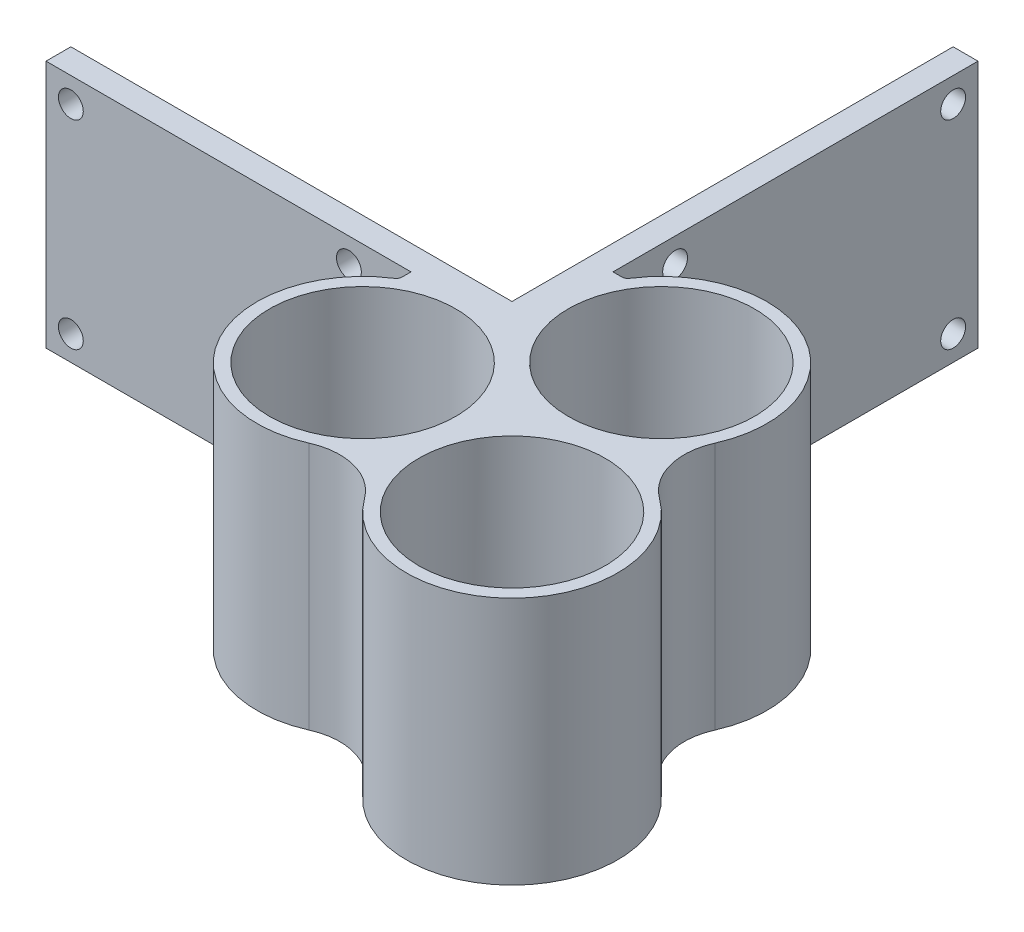
from build123d import *
from build123d.topology import SkipClean

# Parameters (mm, degrees)
SKETCH1_W            = 30
SKETCH1_H            = 30
BOSS_EXTRUDE1_DEPTH  = 80
SKETCH2_R            = 6
BOSS_EXTRUDE2_DEPTH  = 22
CUT_EXTRUDE1_DEPTH   = 83.764726786
BOSS_EXTRUDE3_DEPTH  = 100
BOSS_EXTRUDE5_DEPTH  = 2
BOSS_EXTRUDE6_DEPTH  = 23
BOSS_EXTRUDE7_DEPTH  = 25
FILLET1_R            = 2
SKETCH11_R           = 6.055782361
CUT_EXTRUDE2_DEPTH   = 2.125
SKETCH12_W           = 13.25
SKETCH12_H           = 8.5
CUT_EXTRUDE4_DEPTH   = 13.25
CUT_EXTRUDE5_REACH   = 204.341
SKETCH15_W           = 3.75
SKETCH15_H           = 3.75
FILLET2_R            = 1
CUT_EXTRUDE7_START   = 22
SKETCH16_R           = 6
CUT_EXTRUDE7_DEPTH   = 22
SKETCH17_R           = 15
BOSS_EXTRUDE8_DEPTH  = 40
FILLET3_R            = 1
SKETCH18_R           = 15
SKETCH18_R_2         = 7.5
BOSS_EXTRUDE9_DEPTH  = 2
SKETCH22_R           = 209.016423622
CUT_EXTRUDE8_DEPTH   = 225.815151847
SKETCH23_W           = 22.070362909
SKETCH23_H           = 16.212180161
CUT_EXTRUDE9_DEPTH   = 65.514197169
SKETCH24_R           = 15
BOSS_EXTRUDE10_DEPTH = 40
SKETCH25_R           = 15
SKETCH25_R_2         = 7.5
BOSS_EXTRUDE11_DEPTH = 2
BOSS_EXTRUDE12_DEPTH = 40
SKETCH29_R           = 2
CUT_EXTRUDE10_DEPTH  = 209.128716183
SKETCH30_R           = 3.025
CUT_EXTRUDE11_DEPTH  = 2.1


with BuildPart() as part:
    # Sketch1 → Boss-Extrude1 (new body)
    with BuildSketch(Plane(origin=(0, 0, 0), x_dir=(1, 0, 0), z_dir=(0, 1, 0))):
        Rectangle(SKETCH1_W, SKETCH1_H)
    extrude(amount=BOSS_EXTRUDE1_DEPTH)

    # Sketch2 → Boss-Extrude2 (add)
    with BuildSketch(Plane(origin=(0, 80, 0), x_dir=(1, 0, 0), z_dir=(0, 1, 0))):
        with Locations(Location((9, -9, 0), (0, 0, 270))):
            Circle(SKETCH2_R)
    extrude(amount=BOSS_EXTRUDE2_DEPTH)

    # Sketch3 → Cut-Extrude1 (cut, through all)
    with BuildSketch(Plane(origin=(0, 80, 0), x_dir=(1, 0, 0), z_dir=(0, 1, 0))):
        with BuildLine():
            Line((9, -15), (15, -15))
            Line((15, -15), (15, -9))
            ThreePointArc((15, -9), (13.242640687, -13.242640687), (9, -15))
        make_face()
    extrude(amount=-CUT_EXTRUDE1_DEPTH, mode=Mode.SUBTRACT)

    # Sketch4 → Boss-Extrude3 (add)
    with BuildSketch(Plane(origin=(0, 80, 0), x_dir=(1, 0, 0), z_dir=(0, 1, 0))):
        Polygon((-8.25, 11.25), (-8.25, 8.25), (-11.25, 8.25), (-15, 8.25), (-15, 11.25), (-11.25, 11.25), (-11.25, 15), (-8.25, 15), align=None)
        Polygon((-1.75, 1.75), (-11.25, 1.75), (-15, 1.75), (-15, -1.25), (-11.25, -1.25), (1.25, -1.25), (1.25, 11.25), (1.25, 15), (-1.75, 15), (-1.75, 11.25), align=None)
    extrude(amount=BOSS_EXTRUDE3_DEPTH)

    # Sketch6 → Boss-Extrude5 (add)
    with BuildSketch(Plane.XZ):
        with BuildLine():
            Line((15, -15), (7, -15))
            Line((7, -15), (7, -99.5))
            ThreePointArc((7, -99.5), (2.757359313, -109.742640687), (13, -105.5))
            Line((13, -105.5), (15, -105.5))
            Line((15, -105.5), (15, -15))
        make_face()
    extrude(amount=-BOSS_EXTRUDE5_DEPTH)

    # Sketch7 → Boss-Extrude6 (add)
    with SkipClean():  # the faces are left unmerged after this step: merging them gives an invalid solid
        with BuildSketch(Plane(origin=(0, 2, 0), x_dir=(1, 0, 0), z_dir=(0, 1, 0))):
            with BuildLine():
                Line((9, 111.156854249), (9, 108.964101615))
                ThreePointArc((9, 108.964101615), (7, 101.5), (5, 108.964101615))
                Line((5, 108.964101615), (5, 111.156854249))
                ThreePointArc((5, 111.156854249), (1.086408642, 104.485388128), (7, 99.5))
                Line((7, 99.5), (7, 15))
                Line((7, 15), (15, 15))
                Line((15, 15), (15, 105.5))
                Line((15, 105.5), (13, 105.5))
                ThreePointArc((13, 105.5), (11.898979486, 108.964101615), (9, 111.156854249))
            make_face()
        extrude(amount=BOSS_EXTRUDE6_DEPTH)

    # Sketch9 → Boss-Extrude7 (add)
    with SkipClean():  # the faces are left unmerged after this step: merging them gives an invalid solid
        with BuildSketch(Plane.XZ):
            with BuildLine():
                Line((-15, 15), (-15, 7))
                Line((-15, 7), (-126.175, 7))
                ThreePointArc((-126.175, 7), (-126.252697751, 6.037536458), (-126.48377869, 5.1))
                Line((-126.48377869, 5.1), (-128.797778509, 5.1))
                ThreePointArc((-128.797778509, 5.1), (-136.05, 7), (-128.797778509, 8.9))
                Line((-128.797778509, 8.9), (-126.3, 8.9))
                ThreePointArc((-126.3, 8.9), (-128.491885554, 11.955834237), (-132.050001601, 13.173329766))
                Line((-132.050001601, 13.173329766), (-132.050001601, 15))
                Line((-132.050001601, 15), (-15, 15))
            make_face()
        extrude(amount=-BOSS_EXTRUDE7_DEPTH)

    # Fillet1
    fillet1_edges = [part.edges().sort_by_distance(p)[0] for p in [
        (-126.175, 12.5, 7),
    ]]
    fillet(fillet1_edges, radius=FILLET1_R)

    # Sketch11 → Cut-Extrude2 (cut)
    with SkipClean():  # the faces are left unmerged after this step: merging them gives an invalid solid
        with BuildSketch(Plane.XZ):
            with Locations((-132.175, 7)):
                Circle(SKETCH11_R)
        extrude(amount=-CUT_EXTRUDE2_DEPTH, mode=Mode.SUBTRACT)

    # Sketch12 → Cut-Extrude4 (cut)
    with SkipClean():  # the faces are left unmerged after this step: merging them gives an invalid solid
        with BuildSketch(Plane.ZY.offset(15)):
            with Locations((-8.375, 72.75)):
                Rectangle(SKETCH12_W, SKETCH12_H)
        extrude(amount=-CUT_EXTRUDE4_DEPTH, mode=Mode.SUBTRACT)

    # Sketch15 → Cut-Extrude5 (cut, up to next)
    with BuildSketch(Plane(origin=(0, 80, 0), x_dir=(1, 0, 0), z_dir=(0, 1, 0)), mode=Mode.PRIVATE) as cut_extrude5_sk1:
        with Locations((-13.125, 13.125)):
            Rectangle(SKETCH15_W, SKETCH15_H)
    cut_extrude5_tool1 = extrude(cut_extrude5_sk1.sketch, amount=-CUT_EXTRUDE5_REACH, mode=Mode.PRIVATE) & part.part
    add(cut_extrude5_tool1.solids().sort_by_distance((-13.125, 80, -13.125))[0], mode=Mode.SUBTRACT)

    # Fillet2
    fillet2_edges = [part.edges().sort_by_distance(p)[0] for p in [
        (-11.25, 130, -15),
        (-11.25, 130, -11.25),
        (-15, 130, -11.25),
        (-15, 130, 1.25),
        (1.25, 130, -15),
    ]]
    fillet(fillet2_edges, radius=FILLET2_R)

    # Sketch16 → Cut-Extrude7 (cut)
    with SkipClean():  # the faces are left unmerged after this step: merging them gives an invalid solid
        with BuildSketch(Plane(origin=(0, 80, 0), x_dir=(1, 0, 0), z_dir=(0, 1, 0)).offset(CUT_EXTRUDE7_START)):
            with Locations((9, -9)):
                Circle(SKETCH16_R)
        extrude(amount=-CUT_EXTRUDE7_DEPTH, mode=Mode.SUBTRACT)


with BuildPart() as cut_extrude7_kept_piece:
    # of the separate pieces the step leaves, the one the design keeps (cut_extrude7_pieces_kept)
    add(part.part.solids().sort_by_distance((-15, 80, 0.25))[0])

    # Sketch17 → Boss-Extrude8 (add)
    with SkipClean():  # the faces are left unmerged after this step: merging them gives an invalid solid
        with BuildSketch(Plane(origin=(0, 180, 0), x_dir=(1, 0, 0), z_dir=(0, 1, 0))):
            with BuildLine():
                Line((-14, -1.25), (-14, -4.216394713))
                ThreePointArc((-14, -4.216394713), (-14.384018227, -33.129332993), (11.657578086, -20.561885701))
                ThreePointArc((11.657578086, -20.561885701), (14.532144442, -14.532144442), (20.561885701, -11.657578086))
                ThreePointArc((20.561885701, -11.657578086), (33.129332993, 14.384018227), (4.216394713, 14))
                Line((4.216394713, 14), (1.25, 14))
                Line((1.25, 14), (1.25, -1.25))
                Line((1.25, -1.25), (-14, -1.25))
            make_face()
            with Locations(Location((18.79163056, 5.25, 0), (0, 0, 270))):
                Circle(SKETCH17_R, mode=Mode.SUBTRACT)
            with Locations(Location((-5.25, -18.79163056, 0), (0, 0, 270))):
                Circle(SKETCH17_R, mode=Mode.SUBTRACT)
        extrude(amount=-BOSS_EXTRUDE8_DEPTH)

    # Fillet3
    # the kernel refuses this fillet: 1 mm, written as the material it adds along each edge
    with BuildSketch(Plane(origin=(-14, 140, 1.25), x_dir=(-0.9659258262890684, 0, -0.25881904510252046), z_dir=(0, 1, 0))) as fillet3_piece_1:
        with BuildLine():
            CenterArc((0.776457135, 0.965925826), FILLET3_R, 195, 60)
            Line((-0.189468691, 0.707106781), (0, 0))
            ThreePointArc((0, 0), (0.258819045, 0.034074174), (0.51763809, 0))
        make_face()
    extrude(amount=40)
    with BuildSketch(Plane(origin=(-14, 180, 4.216394713), x_dir=(0, 0, -1), z_dir=(0, -1, 0))) as fillet3_piece_2:
        with BuildLine():
            CenterArc((0.555444904, -1), FILLET3_R, 90, 57.202831704)
            ThreePointArc((-0.285148471, -0.458333333), (-0.140754957, -0.230298516), (0, 0))
            Line((0, 0), (0.555444904, 0))
        make_face()
    extrude(amount=40)
    with BuildSketch(Plane(origin=(1.25, 140, -14), x_dir=(-0.2588190451025201, 0, -0.9659258262890685), z_dir=(0, 1, 0))) as fillet3_piece_3:
        with BuildLine():
            CenterArc((0.776457135, -0.965925826), FILLET3_R, 105, 60)
            Line((-0.189468691, -0.707106781), (0, 0))
            ThreePointArc((0, 0), (0.258819045, -0.034074174), (0.51763809, 0))
        make_face()
    extrude(amount=40)
    with BuildSketch(Plane(origin=(4.216394713, 180, -14), x_dir=(-1, 0, 0), z_dir=(0, -1, 0))) as fillet3_piece_4:
        with BuildLine():
            CenterArc((0.555444904, 1), FILLET3_R, 212.797168296, 57.202831704)
            ThreePointArc((-0.285148471, 0.458333333), (-0.140754957, 0.230298516), (0, 0))
            Line((0, 0), (0.555444904, 0))
        make_face()
    extrude(amount=40)

    # Sketch18 → Boss-Extrude9 (add)
    with SkipClean():  # the faces are left unmerged after this step: merging them gives an invalid solid
        with BuildSketch(Plane.XZ.offset(-140)):
            with Locations(Location((-5.25, 18.79163056, 0), (0, 0, 90))):
                Circle(SKETCH18_R)
            with Locations(Location((-5.25, 18.79163056, 0), (0, 0, 270))):
                Circle(SKETCH18_R_2, mode=Mode.SUBTRACT)
        boss_extrude9 = extrude(amount=-BOSS_EXTRUDE9_DEPTH)

    # Sketch21 → Revolve1 (revolve)
    with SkipClean():  # the faces are left unmerged after this step: merging them gives an invalid solid
        with BuildSketch(Plane(origin=(-5.25, 0, 0), x_dir=(0, 0, -1), z_dir=(-1, 0, 0)), mode=Mode.PRIVATE) as revolve1_sk:
            Polygon((-11.29163056, -142), (-3.79163056, -154.5), (-3.79163056, -142), align=None)
        revolve1 = revolve(revolve1_sk.sketch.rotate(Axis((-5.25, 1065, 18.79163056), (0, -1, 0)), 180), axis=Axis((-5.25, 1065, 18.79163056), (0, -1, 0)))

    # Mirror1: Boss-Extrude9, Revolve1 across plane
    with SkipClean():  # the faces are left unmerged after this step: merging them gives an invalid solid
        add(boss_extrude9.mirror(Plane(origin=(0, 0, 0), x_dir=(0.7071067811865478, 0, 0.7071067811865472), z_dir=(0.7071067811865475, 0, -0.7071067811865477))))
        add(revolve1.mirror(Plane(origin=(0, 0, 0), x_dir=(0.7071067811865478, 0, 0.7071067811865472), z_dir=(0.7071067811865475, 0, -0.7071067811865477))))

    # Sketch22 → Cut-Extrude8 (cut, through all)
    with BuildSketch(Plane.XZ.offset(-140)):
        Circle(SKETCH22_R)
    extrude(amount=CUT_EXTRUDE8_DEPTH, mode=Mode.SUBTRACT)


with BuildPart() as cut_extrude8_piece_1:
    # of the separate pieces the step leaves, piece 1, a body of its own (cut_extrude8_pieces)
    add(cut_extrude7_kept_piece.part.solids().sort_by_distance((4.501543184, 180, -14.458333333))[0])

    # Sketch24 → Boss-Extrude10 (add)
    with BuildSketch(Plane(origin=(0, 180, 0), x_dir=(1, 0, 0), z_dir=(0, 1, 0))):
        with BuildLine():
            ThreePointArc((13.834213525, -37.57835306), (39.612293374, -39.612293374), (37.57835306, -13.834213525))
            ThreePointArc((37.57835306, -13.834213525), (33.79372713, -8.329895406), (34.31915027, -1.67070312))
            ThreePointArc((34.31915027, -1.67070312), (28.778505526, -8.507264569), (20.561885701, -11.657578086))
            ThreePointArc((20.561885701, -11.657578086), (14.532144442, -14.532144442), (11.657578086, -20.561885701))
            ThreePointArc((11.657578086, -20.561885701), (8.507264569, -28.778505526), (1.67070312, -34.31915027))
            ThreePointArc((1.67070312, -34.31915027), (8.329895406, -33.79372713), (13.834213525, -37.57835306))
        make_face()
        with Locations(Location((27.591478094, -27.591478094, 0), (0, 0, 270))):
            Circle(SKETCH24_R, mode=Mode.SUBTRACT)
    extrude(amount=-BOSS_EXTRUDE10_DEPTH)

    # Sketch25 → Boss-Extrude11 (add)
    with BuildSketch(Plane.XZ.offset(-140)):
        with Locations(Location((27.591478094, 27.591478094, 0), (0, 0, 90))):
            Circle(SKETCH25_R)
        with Locations(Location((27.591478094, 27.591478094, 0), (0, 0, 270))):
            Circle(SKETCH25_R_2, mode=Mode.SUBTRACT)
    extrude(amount=-BOSS_EXTRUDE11_DEPTH)

    # Sketch26 → Revolve2 (revolve)
    with BuildSketch(Plane(origin=(0, 0, 0), x_dir=(-0.7071067811865476, 0, -0.7071067811865475), z_dir=(0.7071067811865475, 0, -0.7071067811865476)), mode=Mode.PRIVATE) as revolve2_sk:
        Polygon((-24.020242526, 142), (-24.020242526, 154.5), (-31.520242526, 142), align=None)
    revolve(revolve2_sk.sketch.rotate(Axis((27.591478094, 126.995387654, 27.591478094), (0, 1, 0)), 135), axis=Axis((27.591478094, 126.995387654, 27.591478094), (0, 1, 0)))

    # Sketch27 → Boss-Extrude12 (add)
    with BuildSketch(Plane(origin=(0, 180, 0), x_dir=(1, 0, 0), z_dir=(0, 1, 0))):
        Polygon((2.25, -2.25), (2.25, 72.75), (-1.75, 72.75), (-1.75, 1.75), (-72.75, 1.75), (-72.75, -2.25), align=None)
    extrude(amount=-BOSS_EXTRUDE12_DEPTH)

    # Sketch29 → Cut-Extrude10 (cut, through all)
    with BuildSketch(Plane.XY.offset(2.25)):
        with Locations((-24, 144)):
            Circle(SKETCH29_R)
        with Locations((-24, 176)):
            Circle(SKETCH29_R)
        with Locations((-68.75, 144)):
            Circle(SKETCH29_R)
        with Locations((-68.75, 176)):
            Circle(SKETCH29_R)
    cut_extrude10 = extrude(amount=-CUT_EXTRUDE10_DEPTH, mode=Mode.SUBTRACT)

    # Sketch30 → Cut-Extrude11 (cut)
    with BuildSketch(Plane(origin=(0, 0, -1.75), x_dir=(-1, 0, 0), z_dir=(0, 0, -1))):
        with Locations((14.135, 148)):
            Circle(SKETCH30_R)
        with Locations((29.545, 148)):
            Circle(SKETCH30_R)
        with Locations((44.955, 148)):
            Circle(SKETCH30_R)
        with Locations((60.365, 148)):
            Circle(SKETCH30_R)
        with Locations(Location((60.365, 172, 0), (0, 0, 180))):
            Circle(SKETCH30_R)
        with Locations(Location((44.955, 172, 0), (0, 0, 180))):
            Circle(SKETCH30_R)
        with Locations(Location((29.545, 172, 0), (0, 0, 180))):
            Circle(SKETCH30_R)
        with Locations(Location((14.135, 172, 0), (0, 0, 180))):
            Circle(SKETCH30_R)
    cut_extrude11 = extrude(amount=-CUT_EXTRUDE11_DEPTH, mode=Mode.SUBTRACT)

    # Mirror2: Cut-Extrude10, Cut-Extrude11 across plane
    add(cut_extrude10.mirror(Plane(origin=(0, 0, 0), x_dir=(0.7071067811865476, 0, 0.7071067811865475), z_dir=(0.7071067811865475, 0, -0.7071067811865476))), mode=Mode.SUBTRACT)
    add(cut_extrude11.mirror(Plane(origin=(0, 0, 0), x_dir=(0.7071067811865476, 0, 0.7071067811865475), z_dir=(0.7071067811865475, 0, -0.7071067811865476))), mode=Mode.SUBTRACT)


with BuildPart() as cut_extrude8_piece_2:
    # of the separate pieces the step leaves, piece 2, a body of its own (cut_extrude8_pieces)
    add(cut_extrude7_kept_piece.part.solids().sort_by_distance((-10.25, 140, -15))[0])

    # Sketch23 → Cut-Extrude9 (cut, through all)
    with BuildSketch(Plane(origin=(0, 180, 0), x_dir=(1, 0, 0), z_dir=(0, 1, 0))):
        with Locations((-15.719387653, 13.178118111)):
            Rectangle(SKETCH23_W, SKETCH23_H)
    extrude(amount=-CUT_EXTRUDE9_DEPTH, mode=Mode.SUBTRACT)


solid = cut_extrude8_piece_1.part
